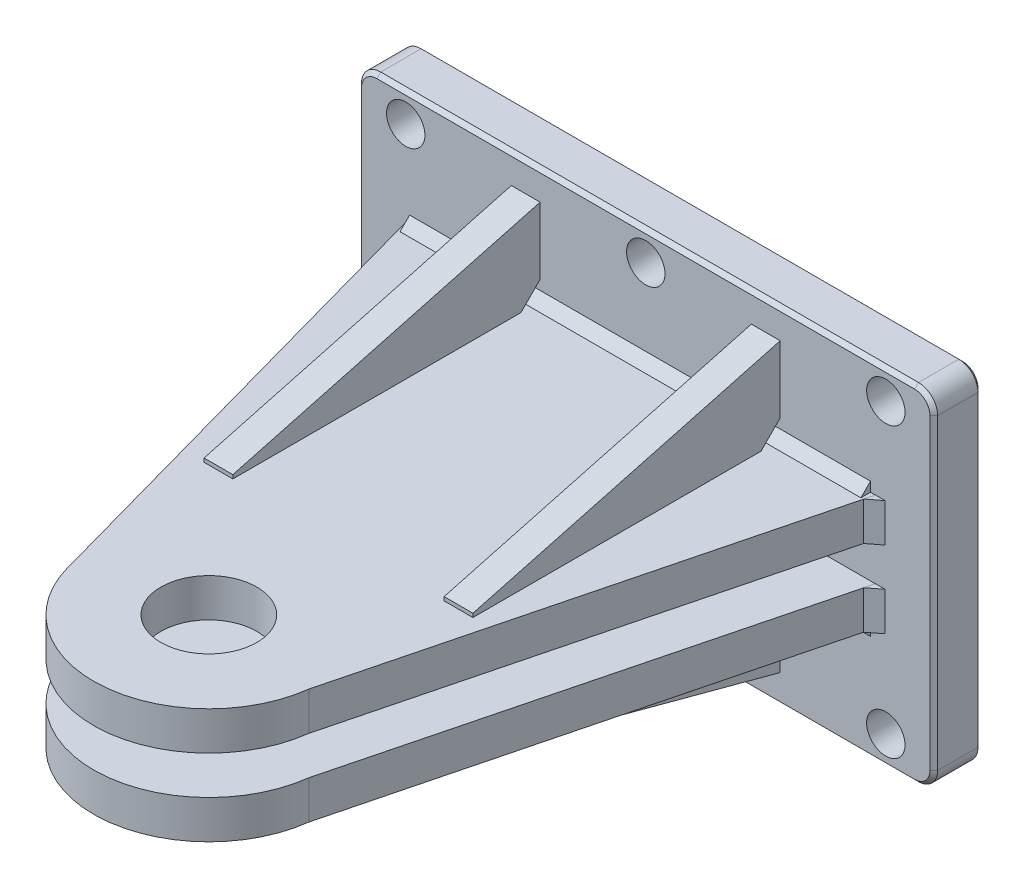
from build123d import *

# Parameters (mm, degrees)
SKETCH2_W           = 300
SKETCH2_H           = 180
SKETCH2_R           = 10
BOSS_EXTRUDE1_DEPTH = 12.5
FILLET1_R           = 10
CHAMFER3_SIZE       = 2
SKETCH3_W           = 245.602376855
SKETCH3_H           = 20
BOSS_EXTRUDE2_DEPTH = 290
SKETCH4_R           = 25
CUT_EXTRUDE2_DEPTH  = 290
SKETCH5_W           = 15
SKETCH5_H           = 44.810981007
BOSS_EXTRUDE3_DEPTH = 160
CUT_EXTRUDE4_DEPTH  = 160
CUT_EXTRUDE5_DEPTH  = 160
GUSSET4_START       = 9.967
GUSSET4_DEPTH       = 20.066
GUSSET5_START       = -30.033
GUSSET5_DEPTH       = 20.066
GUSSET6_THICKNESS   = 240
GUSSET7_THICKNESS   = 240


# Read off the part's stored shape, not the designer's step: Gusset4, Gusset5
with BuildPart() as part:
    # Sketch2 → Boss-Extrude1 (new, symmetric)
    with BuildSketch(Plane.XY):
        Rectangle(SKETCH2_W, SKETCH2_H)
        with Locations((125, 75)):
            Circle(SKETCH2_R, mode=Mode.SUBTRACT)
        with Locations((-125, 75)):
            Circle(SKETCH2_R, mode=Mode.SUBTRACT)
        with Locations((0, 75)):
            Circle(SKETCH2_R, mode=Mode.SUBTRACT)
        with Locations(Location((125, -75, 0), (0, 0, 180))):
            Circle(SKETCH2_R, mode=Mode.SUBTRACT)
        with Locations(Location((0, -75, 0), (0, 0, 180))):
            Circle(SKETCH2_R, mode=Mode.SUBTRACT)
        with Locations(Location((-125, -75, 0), (0, 0, 180))):
            Circle(SKETCH2_R, mode=Mode.SUBTRACT)
    extrude(amount=BOSS_EXTRUDE1_DEPTH, both=True)

    # Fillet1
    fillet1_edges = [part.edges().sort_by_distance(p)[0] for p in [
        (-150, 90, 0),
        (150, 90, 0),
        (150, -90, 0),
        (-150, -90, 0),
    ]]
    fillet(fillet1_edges, radius=FILLET1_R)

    # Chamfer3
    chamfer3_edges = [part.edges().sort_by_distance(p)[0] for p in [
        (-150, 0, -12.5),
        (-150, 0, 12.5),
        (0, 90, -12.5),
        (150, 0, -12.5),
        (0, -90, -12.5),
        (147.071067812, 87.071067812, -12.5),
        (147.071067812, -87.071067812, -12.5),
        (-147.071067812, -87.071067812, -12.5),
        (-147.071067812, 87.071067812, -12.5),
        (0, 90, 12.5),
        (0, -90, 12.5),
        (150, 0, 12.5),
        (147.071067812, 87.071067812, 12.5),
        (147.071067812, -87.071067812, 12.5),
        (-147.071067812, -87.071067812, 12.5),
        (-147.071067812, 87.071067812, 12.5),
    ]]
    chamfer(chamfer3_edges, length=CHAMFER3_SIZE)

    # Sketch3 → Boss-Extrude2 (add)
    with BuildSketch(Plane.XY.offset(12.5)):
        with Locations((-2.712098758, 20)):
            Rectangle(SKETCH3_W, SKETCH3_H)
        with Locations((-2.712098758, -20)):
            Rectangle(SKETCH3_W, SKETCH3_H)
    extrude(amount=BOSS_EXTRUDE2_DEPTH)

    # Sketch4 → Cut-Extrude2 (cut)
    with BuildSketch(Plane(origin=(0, 30, 0), x_dir=(1, 0, 0), z_dir=(0, 1, 0))):
        with Locations(Location((0, -240, 0), (0, 0, 270))):
            Circle(SKETCH4_R)
        with BuildLine():
            Line((120.08908967, -12.5), (119.577955686, -12.5))
            Line((119.577955686, -12.5), (59.538734687, -247.42556879))
            ThreePointArc((59.538734687, -247.42556879), (4.407482246, -299.837898528), (-57.808194698, -256.068995792))
            Line((-57.808194698, -256.068995792), (-125.513287185, -12.5))
            Line((-125.513287185, -12.5), (-125.513287185, -302.5))
            Line((-125.513287185, -302.5), (120.08908967, -302.5))
            Line((120.08908967, -302.5), (120.08908967, -12.5))
        make_face()
    extrude(amount=-CUT_EXTRUDE2_DEPTH, mode=Mode.SUBTRACT)

    # Sketch5 → Boss-Extrude3 (add)
    with BuildSketch(Plane.XY.offset(12.5)):
        with Locations((-62.5, 52.405490504)):
            Rectangle(SKETCH5_W, SKETCH5_H)
        with Locations((62.5, 52.405490504)):
            Rectangle(SKETCH5_W, SKETCH5_H)
        with Locations((-62.5, -52.405490504)):
            Rectangle(SKETCH5_W, SKETCH5_H)
        with Locations((62.5, -52.405490504)):
            Rectangle(SKETCH5_W, SKETCH5_H)
    extrude(amount=BOSS_EXTRUDE3_DEPTH)

    # Sketch6 → Cut-Extrude4 (cut)
    with BuildSketch(Plane(origin=(70, 0, 0), x_dir=(0, 0, -1), z_dir=(1, 0, 0))):
        Polygon((-172.5, 74.810981007), (-12.5, 74.810981007), (-172.5, 117.749424337), align=None)
        Polygon((-172.5, 74.810981007), (-172.5, 31.939110218), (-12.5, 74.810981007), align=None)
        Polygon((-12.5, -74.810981007), (-172.5, -31.939110218), (-172.5, -117.749424337), align=None)
    extrude(amount=-CUT_EXTRUDE4_DEPTH, mode=Mode.SUBTRACT)

    # Sketch8 → Cut-Extrude5 (cut)
    with BuildSketch(Plane(origin=(70, 0, 0), x_dir=(0, 0, -1), z_dir=(1, 0, 0))):
        Polygon((-12.5, 40), (-22.5, 30), (-12.5, 30), align=None)
        Polygon((-12.5, -40), (-12.5, -30), (-22.5, -30), align=None)
    extrude(amount=-CUT_EXTRUDE5_DEPTH, mode=Mode.SUBTRACT)


with BuildPart() as body_2:
    # Gusset4 outline → Gusset4 (new body)
    with BuildSketch(Plane(origin=(0, 0, 0), x_dir=(1, 0, 0), z_dir=(0, 1, 0)).offset(GUSSET4_START)):
        Polygon((118.339912342, -17.344300639), (124.577955686, -12.5), (119.577955686, -12.5), align=None)
    extrude(amount=GUSSET4_DEPTH)


with BuildPart() as body_3:
    # Gusset5 outline → Gusset5 (new body)
    with BuildSketch(Plane(origin=(0, 0, 0), x_dir=(1, 0, 0), z_dir=(0, 1, 0)).offset(GUSSET5_START)):
        Polygon((118.339912342, -17.344300639), (124.577955686, -12.5), (119.577955686, -12.5), align=None)
    extrude(amount=GUSSET5_DEPTH)


with BuildPart() as body_4:
    # Gusset6: a gusset: a plate 240.0 thick in the corner of two members, its outline drawn in place
    gusset6_outline = Wire([Line((-122.96766575, 30, 12.5), (-122.96766575, 30, 17.5)), Line((-122.96766575, 30, 17.5), (-122.96766575, 35, 12.5)), Line((-122.96766575, 35, 12.5), (-122.96766575, 30, 12.5))])
    add(extrude(Face(gusset6_outline), amount=GUSSET6_THICKNESS, dir=(1, 0, 0)))


with BuildPart() as body_5:
    # Gusset7: a gusset: a plate 240.0 thick in the corner of two members, its outline drawn in place
    gusset7_outline = Wire([Line((117.03233425, -30, 12.5), (117.03233425, -30, 17.5)), Line((117.03233425, -30, 17.5), (117.03233425, -35, 12.5)), Line((117.03233425, -35, 12.5), (117.03233425, -30, 12.5))])
    add(extrude(Face(gusset7_outline), amount=GUSSET7_THICKNESS, dir=(-1, 0, 0)))


solid = Compound([part.part, body_2.part, body_3.part, body_4.part, body_5.part])
